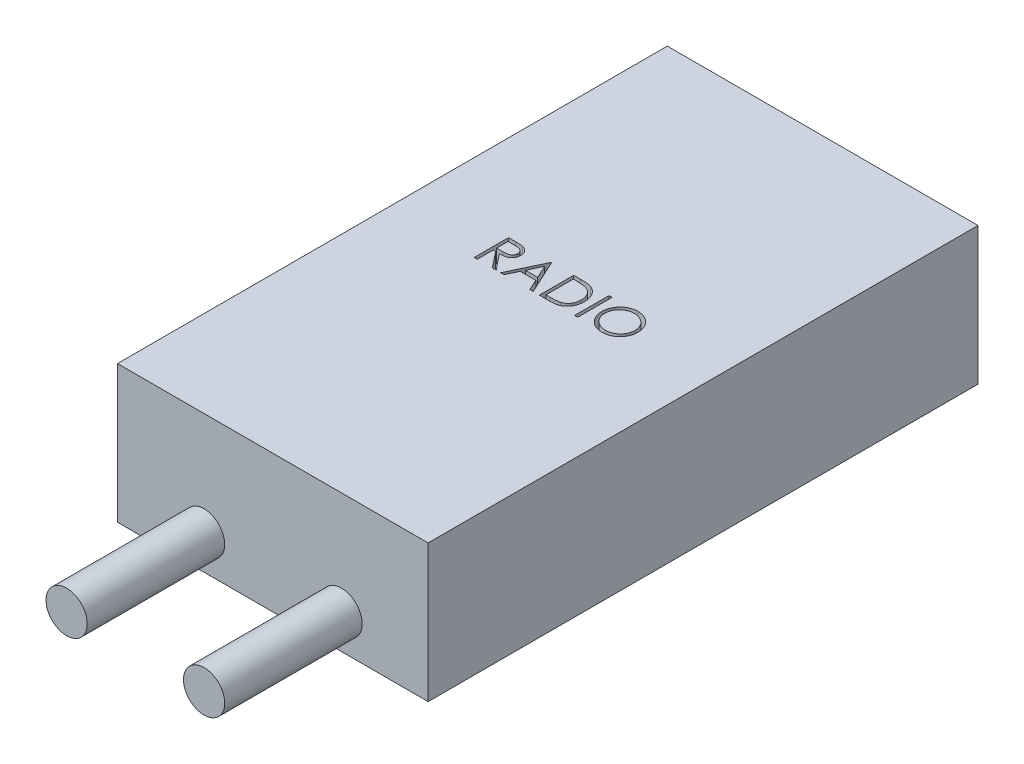
from build123d import *

# Parameters (mm, degrees)
SKETCH1_W           = 28.702
SKETCH1_H           = 50.8
BOSS_EXTRUDE1_DEPTH = 12.7
SKETCH2_R           = 1.905
BOSS_EXTRUDE2_DEPTH = 12.7
SKETCH3_W           = 0.284935897
SKETCH3_H           = 3.175
CUT_EXTRUDE1_DEPTH  = 1.27


with BuildPart() as part:
    # Sketch1 → Boss-Extrude1 (new body)
    with BuildSketch(Plane(origin=(0, 0, 0), x_dir=(1, 0, 0), z_dir=(0, 1, 0))):
        Rectangle(SKETCH1_W, SKETCH1_H)
    extrude(amount=BOSS_EXTRUDE1_DEPTH)

    # Sketch2 → Boss-Extrude2 (add)
    with BuildSketch(Plane.XY.offset(25.4)):
        with Locations((-6.35, 3.175)):
            Circle(SKETCH2_R)
        with Locations((6.35, 3.175)):
            Circle(SKETCH2_R)
    extrude(amount=BOSS_EXTRUDE2_DEPTH)

    # Sketch3 → Cut-Extrude1 (cut)
    # profile 1 of 5: a face of its own
    with BuildSketch(Plane(origin=(0, 12.7, 0), x_dir=(1, 0, 0), z_dir=(0, 1, 0))):
        with BuildLine():
            Line((-6.362474598, 2.738153854), (-5.727092987, 2.738153854))
            add(Edge.make_bspline(
                [(-5.727092987, 2.738153854), (-5.684692106, 2.738012716), (-5.603277718, 2.737741714), (-5.486643394, 2.736230629), (-5.380664528, 2.731899606), (-5.285396531, 2.728172534), (-5.200841151, 2.721376273), (-5.126739108, 2.714880543), (-5.063431697, 2.706377294), (-5.025108675, 2.698480231), (-5.00775705, 2.694904656)],
                knots=[0, 0, 0, 0, 1.410062039, 2.707475311, 3.878576406, 4.937260626, 5.877586885, 6.699081471, 7.410979367, 8, 8, 8, 8], degree=3))
            add(Edge.make_bspline(
                [(-5.00775705, 2.694904656), (-4.984528183, 2.689165376), (-4.938565986, 2.67780925), (-4.872389855, 2.653806612), (-4.809330432, 2.626030238), (-4.749649663, 2.593406006), (-4.693646481, 2.555691742), (-4.640743442, 2.513538517), (-4.590700486, 2.46717698), (-4.545541436, 2.415438231), (-4.50296101, 2.361157969), (-4.46704847, 2.302462418), (-4.436090878, 2.241083746), (-4.411443338, 2.176397732), (-4.39159689, 2.109031696), (-4.377603087, 2.03837543), (-4.369210939, 1.964750831), (-4.368356541, 1.9145333), (-4.367923316, 1.889070321)],
                knots=[0, 0, 0, 0, 1.027469482, 2.033020251, 3.019912614, 3.986113645, 4.951240523, 5.91722682, 6.890402269, 7.87763091, 8.8651537, 9.85103654, 10.82876324, 11.815024772, 12.821070561, 13.842952187, 14.906261191, 16, 16, 16, 16], degree=3))
            add(Edge.make_bspline(
                [(-4.367923316, 1.889070321), (-4.369255907, 1.846765619), (-4.371856137, 1.764218188), (-4.396099624, 1.644420103), (-4.435811181, 1.532669796), (-4.490533022, 1.429107974), (-4.560219261, 1.335753317), (-4.643971036, 1.253756261), (-4.741835069, 1.185140055), (-4.832938805, 1.137557868), (-4.913415258, 1.107084301), (-4.979666906, 1.085642747), (-5.051936236, 1.069076535), (-5.129530818, 1.054235559), (-5.212773562, 1.043030807), (-5.301464955, 1.034824254), (-5.39566825, 1.029695224), (-5.460382977, 1.028931405), (-5.493674518, 1.02853847)],
                knots=[0, 0, 0, 0, 1.260483769, 2.459530307, 3.627416485, 4.787058657, 5.939039949, 7.08810263, 8.267026773, 9.491475466, 10.141966685, 10.831826277, 11.566392101, 12.351337768, 13.187381173, 14.07005841, 15.007169909, 16, 16, 16, 16], degree=3))
            Line((-5.493674518, 1.02853847), (-4.327218187, -0.436846146))
            Line((-4.327218187, -0.436846146), (-4.679571954, -0.436846146))
            Line((-4.679571954, -0.436846146), (-5.846028284, 1.02853847))
            Line((-5.846028284, 1.02853847), (-6.0775387, 1.02853847))
            Line((-6.0775387, 1.02853847), (-6.0775387, -0.436846146))
            Line((-6.0775387, -0.436846146), (-6.362474598, -0.436846146))
            Line((-6.362474598, -0.436846146), (-6.362474598, 2.738153854))
        make_face()
        with BuildLine():
            Line((-6.0775387, 2.412512829), (-6.0775387, 1.354179495))
            Line((-6.0775387, 1.354179495), (-5.496218588, 1.349727372))
            add(Edge.make_bspline(
                [(-5.496218588, 1.349727372), (-5.469076839, 1.349715364), (-5.416468397, 1.34969209), (-5.340358509, 1.353315016), (-5.269492407, 1.357436455), (-5.204141154, 1.363740504), (-5.144275553, 1.37186494), (-5.089925528, 1.382027648), (-5.04100236, 1.393867733), (-4.9839444, 1.412193493), (-4.920229832, 1.441227524), (-4.850986294, 1.483469084), (-4.792019887, 1.536599642), (-4.742201541, 1.597354134), (-4.702169842, 1.664152731), (-4.673946764, 1.736194723), (-4.656037549, 1.811661387), (-4.653925225, 1.863530099), (-4.652859213, 1.889706338)],
                knots=[0, 0, 0, 0, 1.146690395, 2.22261258, 3.21895312, 4.145990853, 4.996080663, 5.770904154, 6.481378293, 7.121626537, 8.300444488, 9.431385265, 10.535395872, 11.636531494, 12.74115979, 13.810798291, 14.895190096, 16, 16, 16, 16], degree=3))
            add(Edge.make_bspline(
                [(-4.652859213, 1.889706338), (-4.653949709, 1.915239302), (-4.656110673, 1.965836318), (-4.673753484, 2.039909894), (-4.703588852, 2.109820627), (-4.743795453, 2.175284124), (-4.792780401, 2.234707185), (-4.850218703, 2.285549959), (-4.914539844, 2.327504831), (-4.974657288, 2.354314876), (-5.028391181, 2.370752171), (-5.07504523, 2.382319299), (-5.127760642, 2.391612495), (-5.186793379, 2.399058379), (-5.25189143, 2.405458222), (-5.323383949, 2.409768764), (-5.4007966, 2.41232134), (-5.454451316, 2.412447514), (-5.4822262, 2.412512829)],
                knots=[0, 0, 0, 0, 1.101028733, 2.181837193, 3.264309656, 4.369019818, 5.486613113, 6.575447106, 7.666700264, 8.788928104, 9.402425223, 10.0903467, 10.862060571, 11.710948788, 12.657782767, 13.684531032, 14.801375019, 16, 16, 16, 16], degree=3))
            Line((-5.4822262, 2.412512829), (-6.0775387, 2.412512829))
        make_face(mode=Mode.SUBTRACT)
    # profile 2 of 5: a face of its own
    with BuildSketch(Plane(origin=(0, 12.7, 0), x_dir=(1, 0, 0), z_dir=(0, 1, 0))):
        Polygon((-2.373372034, 2.738153854), (-0.907987418, -0.436846146), (-1.217728003, -0.436846146), (-1.687109013, 0.58078206), (-3.126416905, 0.58078206), (-3.609154285, -0.436846146), (-3.920166905, -0.436846146), (-2.414077162, 2.738153854), align=None)
        Polygon((-2.396904686, 2.119308702), (-2.971864622, 0.906423085), (-1.837209173, 0.906423085), align=None, mode=Mode.SUBTRACT)
    # profile 3 of 5: a face of its own
    with BuildSketch(Plane(origin=(0, 12.7, 0), x_dir=(1, 0, 0), z_dir=(0, 1, 0))):
        with BuildLine():
            Line((-0.338115623, -0.436846146), (-0.338115623, 2.738153854))
            Line((-0.338115623, 2.738153854), (0.302990146, 2.738153854))
            add(Edge.make_bspline(
                [(0.302990146, 2.738153854), (0.358751299, 2.73775238), (0.466481558, 2.736976734), (0.622158564, 2.732058758), (0.76619812, 2.723358835), (0.898126499, 2.710686479), (1.018305884, 2.695126227), (1.126399765, 2.675622289), (1.222967066, 2.652591592), (1.282357201, 2.632956076), (1.310442069, 2.623670681)],
                knots=[0, 0, 0, 0, 1.314313732, 2.53924729, 3.670748893, 4.714932338, 5.66265055, 6.526160246, 7.303039223, 8, 8, 8, 8], degree=3))
            add(Edge.make_bspline(
                [(1.310442069, 2.623670681), (1.347176582, 2.609672827), (1.419812593, 2.581994543), (1.523233339, 2.529782755), (1.620592776, 2.470625156), (1.712413, 2.404443766), (1.796596607, 2.329364679), (1.876432342, 2.24857718), (1.94865427, 2.159143471), (2.01479251, 2.062918303), (2.074424144, 1.961035227), (2.126257523, 1.853688379), (2.169305074, 1.741422911), (2.205040358, 1.624551027), (2.23320393, 1.502815742), (2.252418968, 1.376075306), (2.265092652, 1.244830613), (2.266366327, 1.155772349), (2.267012582, 1.110584744)],
                knots=[0, 0, 0, 0, 0.984719456, 1.947108742, 2.898477687, 3.838006223, 4.779231079, 5.722358779, 6.681677486, 7.655904652, 8.64651281, 9.637519902, 10.640069247, 11.656948941, 12.698408672, 13.768548281, 14.867775369, 16, 16, 16, 16], degree=3))
            add(Edge.make_bspline(
                [(2.267012582, 1.110584744), (2.266442018, 1.07134062), (2.265317664, 0.994005976), (2.255221784, 0.880031735), (2.240547551, 0.76943871), (2.217828886, 0.662753539), (2.190249463, 0.559041513), (2.154903412, 0.459407977), (2.11441264, 0.36293895), (2.067195964, 0.270938811), (2.015360565, 0.183777466), (1.959732984, 0.101612523), (1.900372553, 0.025616428), (1.836713229, -0.044440955), (1.769577658, -0.108454016), (1.698526301, -0.166957487), (1.623375819, -0.218806647), (1.544462806, -0.266038953), (1.459485174, -0.307241704), (1.366833353, -0.342103213), (1.266112213, -0.370992642), (1.157568981, -0.395096241), (1.041016112, -0.414216365), (0.916339335, -0.427031021), (0.783730208, -0.435696896), (0.692671875, -0.436455624), (0.645803647, -0.436846146)],
                knots=[0, 0, 0, 0, 1.105936401, 2.179363191, 3.223086493, 4.248585256, 5.251745608, 6.245858792, 7.225916811, 8.198733463, 9.158002045, 10.082870192, 10.993790845, 11.873723703, 12.748670949, 13.606408763, 14.465103618, 15.319838547, 16.196477973, 17.123216899, 18.106603292, 19.147568657, 20.255746949, 21.433717677, 22.679120308, 24, 24, 24, 24], degree=3))
            Line((0.645803647, -0.436846146), (-0.338115623, -0.436846146))
        make_face()
        with BuildLine():
            Line((-0.053179726, -0.11120512), (0.311258375, -0.11120512))
            add(Edge.make_bspline(
                [(0.311258375, -0.11120512), (0.363626254, -0.110980061), (0.464348864, -0.110547191), (0.609181476, -0.106748799), (0.741514929, -0.100542184), (0.861368012, -0.091856221), (0.968673056, -0.080363977), (1.063654314, -0.067550673), (1.146000442, -0.051587271), (1.195829288, -0.037117472), (1.21885553, -0.030430881)],
                knots=[0, 0, 0, 0, 1.375205317, 2.645023457, 3.804390687, 4.853969522, 5.800190428, 6.637939096, 7.370582563, 8, 8, 8, 8], degree=3))
            add(Edge.make_bspline(
                [(1.21885553, -0.030430881), (1.247837259, -0.020224111), (1.305108488, -5.4358e-05), (1.387550615, 0.036737235), (1.464437327, 0.080318255), (1.537108564, 0.128761747), (1.604533458, 0.183776334), (1.66751105, 0.244165731), (1.725914541, 0.310237277), (1.77914052, 0.381908967), (1.826773053, 0.45873471), (1.868021954, 0.539959223), (1.904172986, 0.624692544), (1.932547138, 0.714235852), (1.954786275, 0.807788641), (1.970538528, 0.905357492), (1.980349028, 1.006924183), (1.981493341, 1.076005039), (1.982076684, 1.111220761)],
                knots=[0, 0, 0, 0, 0.998632004, 1.973411704, 2.929992603, 3.868527914, 4.809262121, 5.754881198, 6.702106254, 7.672490631, 8.653608572, 9.636854334, 10.631411391, 11.644891563, 12.686317036, 13.754757253, 14.855430412, 16, 16, 16, 16], degree=3))
            add(Edge.make_bspline(
                [(1.982076684, 1.111220761), (1.981611059, 1.148353276), (1.980696335, 1.221300429), (1.969198925, 1.328334845), (1.952397228, 1.431278007), (1.928100599, 1.530136798), (1.897139016, 1.625104089), (1.858499591, 1.715654645), (1.814352015, 1.802744776), (1.761825416, 1.884364379), (1.704298414, 1.961555985), (1.640455623, 2.03227223), (1.571311345, 2.096674202), (1.497619732, 2.155764865), (1.417303935, 2.207166913), (1.332255944, 2.253146974), (1.241228085, 2.292168533), (1.177897996, 2.31292293), (1.145713503, 2.323470361)],
                knots=[0, 0, 0, 0, 1.122418816, 2.205001699, 3.251619955, 4.274784885, 5.280384055, 6.268708349, 7.249350384, 8.229342522, 9.199999885, 10.157847722, 11.105861043, 12.055065948, 13.010012805, 13.98527497, 14.976112212, 16, 16, 16, 16], degree=3))
            add(Edge.make_bspline(
                [(1.145713503, 2.323470361), (1.11908782, 2.33083312), (1.062474314, 2.346488367), (0.970091371, 2.36356567), (0.866119057, 2.378628322), (0.750095757, 2.391380972), (0.622153726, 2.400531614), (0.482194566, 2.407399878), (0.330157782, 2.412032323), (0.224763626, 2.41234865), (0.170062462, 2.412512829)],
                knots=[0, 0, 0, 0, 0.674548936, 1.434276114, 2.292660221, 3.240891867, 4.284742987, 5.42552168, 6.663806718, 8, 8, 8, 8], degree=3))
            Line((0.170062462, 2.412512829), (-0.053179726, 2.412512829))
            Line((-0.053179726, 2.412512829), (-0.053179726, -0.11120512))
        make_face(mode=Mode.SUBTRACT)
    # profile 4 of 5: a face of its own
    with BuildSketch(Plane(origin=(0, 12.7, 0), x_dir=(1, 0, 0), z_dir=(0, 1, 0))):
        with Locations((3.060762582, 1.150653854)):
            Rectangle(SKETCH3_W, SKETCH3_H)
    # profile 5 of 5: a face of its own
    with BuildSketch(Plane(origin=(0, 12.7, 0), x_dir=(1, 0, 0), z_dir=(0, 1, 0))):
        with BuildLine():
            add(Edge.make_bspline(
                [(5.503070274, 2.819564111), (5.561860484, 2.818075055), (5.677329308, 2.815150425), (5.847032965, 2.792762953), (6.00904423, 2.754032135), (6.164682856, 2.702449286), (6.312087199, 2.633638522), (6.452366766, 2.550466995), (6.585187787, 2.45206335), (6.70876004, 2.339188266), (6.821841702, 2.216376133), (6.921469471, 2.085314028), (7.00496498, 1.946794401), (7.073532087, 1.801233504), (7.127324397, 1.648960533), (7.164443815, 1.489163688), (7.188154852, 1.322878333), (7.190926878, 1.209461106), (7.192333095, 1.15192589)],
                knots=[0, 0, 0, 0, 1.065120563, 2.091984664, 3.0946048, 4.079830382, 5.057816894, 6.036188127, 7.030412546, 8.04752943, 9.064399622, 10.05169764, 11.02544977, 11.989514704, 12.962713494, 13.945757189, 14.957906945, 16, 16, 16, 16], degree=3))
            add(Edge.make_bspline(
                [(7.192333095, 1.15192589), (7.190927084, 1.094814492), (7.188155675, 0.98224131), (7.164416856, 0.817011186), (7.127186806, 0.658178911), (7.074031621, 0.506009641), (7.005791366, 0.360342851), (6.921739889, 0.221561828), (6.82273322, 0.089621076), (6.710059862, -0.034033984), (6.587231774, -0.147424547), (6.455487175, -0.246229527), (6.317788949, -0.331250697), (6.172365142, -0.399090173), (6.021144394, -0.453311844), (5.862773287, -0.490280301), (5.697993913, -0.514126404), (5.585625217, -0.51686463), (5.528510979, -0.518256402)],
                knots=[0, 0, 0, 0, 1.043624062, 2.057103931, 3.04512605, 4.022047818, 4.998200453, 5.980619268, 6.982898556, 8.009068085, 9.034988726, 10.034168286, 11.015286542, 11.987931943, 12.962482838, 13.94673481, 14.956375938, 16, 16, 16, 16], degree=3))
            add(Edge.make_bspline(
                [(5.528510979, -0.518256402), (5.470976061, -0.516850887), (5.357559423, -0.514080242), (5.191065112, -0.490329968), (5.031156016, -0.453190357), (4.878289426, -0.400113939), (4.732380097, -0.331518309), (4.593142664, -0.247875765), (4.461136009, -0.148627858), (4.337454568, -0.035991037), (4.224289224, 0.086628871), (4.125628933, 0.218014231), (4.04196758, 0.355587395), (3.973602272, 0.499730149), (3.919478083, 0.649745672), (3.882552998, 0.806634648), (3.858662528, 0.969502629), (3.855909488, 1.080394401), (3.854512582, 1.136661467)],
                knots=[0, 0, 0, 0, 1.053102029, 2.075944431, 3.073151272, 4.055350789, 5.033113405, 6.020478099, 7.024410459, 8.052272461, 9.079885166, 10.07527673, 11.055994387, 12.023226415, 12.992069828, 13.970394897, 14.97016774, 16, 16, 16, 16], degree=3))
            add(Edge.make_bspline(
                [(3.854512582, 1.136661467), (3.854997573, 1.174428245), (3.855961436, 1.249485357), (3.867565328, 1.360942916), (3.884403443, 1.470608012), (3.908535178, 1.578168801), (3.94009619, 1.68336198), (3.977336243, 1.786913029), (4.022820246, 1.88777255), (4.074237691, 1.986418341), (4.131625188, 2.081312656), (4.195012475, 2.171010563), (4.262173131, 2.256264753), (4.335799924, 2.334865964), (4.41346627, 2.409100781), (4.496432085, 2.477828388), (4.584191121, 2.541668522), (4.677120994, 2.599199832), (4.772931858, 2.651232761), (4.871698649, 2.695884011), (4.972079967, 2.734207224), (5.074545969, 2.765268544), (5.178824555, 2.789790463), (5.285143317, 2.806488562), (5.393417554, 2.818122051), (5.466362107, 2.819081356), (5.503070274, 2.819564111)],
                knots=[0, 0, 0, 0, 1.037015668, 2.060948919, 3.074880161, 4.083647147, 5.086022904, 6.090072063, 7.104153813, 8.122640571, 9.144368836, 10.147691507, 11.138137339, 12.123020368, 13.103399296, 14.087645067, 15.080126199, 16.082011238, 17.087798457, 18.072939717, 19.057185487, 20.037253025, 21.01195951, 21.997135196, 22.992090687, 24, 24, 24, 24], degree=3))
        make_face()
        with BuildLine():
            add(Edge.make_bspline(
                [(5.517062662, 2.493923085), (5.486932244, 2.493555792), (5.426959458, 2.492824717), (5.337801343, 2.483194746), (5.249815803, 2.469469775), (5.162984667, 2.449892253), (5.077671248, 2.423218576), (4.99308032, 2.392520038), (4.909983264, 2.35512662), (4.828654408, 2.312878524), (4.749810018, 2.266116289), (4.675412782, 2.214434758), (4.605270097, 2.159045926), (4.539553706, 2.099820531), (4.478456571, 2.036456963), (4.420776163, 1.969915825), (4.368824471, 1.898295181), (4.321212555, 1.823537169), (4.278606014, 1.745739163), (4.240718871, 1.665720217), (4.209727234, 1.582827601), (4.184452079, 1.497960615), (4.16349725, 1.41125367), (4.150222191, 1.322049007), (4.140486407, 1.230794869), (4.139797119, 1.169125616), (4.139448479, 1.137933502)],
                knots=[0, 0, 0, 0, 1.008559885, 2.007477868, 2.99961109, 3.989939068, 4.984837346, 5.991145699, 7.001802488, 8.033829008, 9.059044045, 10.069351652, 11.065060232, 12.050310815, 13.029377138, 14.011219647, 14.996725999, 15.989392538, 16.977580475, 17.965360261, 18.951710183, 19.937753436, 20.929683414, 21.935841486, 22.955955122, 24, 24, 24, 24], degree=3))
            add(Edge.make_bspline(
                [(4.139448479, 1.137933502), (4.140604961, 1.092066344), (4.142880119, 1.001831456), (4.162798772, 0.869598926), (4.193480134, 0.742518837), (4.238707888, 0.621286534), (4.295268803, 0.504859935), (4.365143196, 0.394271868), (4.447928224, 0.289492446), (4.541965851, 0.191253167), (4.644765735, 0.101585901), (4.753924712, 0.022879095), (4.868273341, -0.043714489), (4.988109818, -0.097966233), (5.112794371, -0.140955495), (5.243130436, -0.170418253), (5.378249781, -0.189808845), (5.47035259, -0.191670988), (5.517062662, -0.192615376)],
                knots=[0, 0, 0, 0, 1.032063989, 2.030389145, 3.003944642, 3.970395727, 4.937377036, 5.913328081, 6.909231446, 7.93887556, 8.970685674, 9.976071282, 10.964166581, 11.944589148, 12.933237628, 13.927779006, 14.949070134, 16, 16, 16, 16], degree=3))
            add(Edge.make_bspline(
                [(5.517062662, -0.192615376), (5.548458424, -0.192184026), (5.61072565, -0.191328529), (5.703340874, -0.182711872), (5.79428758, -0.16889439), (5.883438205, -0.149000153), (5.97069157, -0.124101615), (6.056411856, -0.094521748), (6.139686019, -0.057618085), (6.221564586, -0.016843871), (6.29993832, 0.029638272), (6.37475541, 0.079565736), (6.444130049, 0.134872985), (6.509797278, 0.193218429), (6.571145253, 0.255778491), (6.627759117, 0.322471835), (6.679448237, 0.393719431), (6.727042073, 0.468364049), (6.769499319, 0.546374936), (6.806491787, 0.626684001), (6.837875407, 0.709093493), (6.86321055, 0.793722275), (6.883063791, 0.880409617), (6.896743432, 0.969271588), (6.906312373, 1.06013042), (6.907033622, 1.121583775), (6.907397197, 1.152561907)],
                knots=[0, 0, 0, 0, 1.047197238, 2.076906641, 3.100256066, 4.114471768, 5.12198147, 6.126382909, 7.136867548, 8.15857795, 9.17633901, 10.174870724, 11.156907918, 12.133735059, 13.104061851, 14.077631395, 15.04955518, 16.038496417, 17.029181396, 18.010275684, 18.986308667, 19.968651475, 20.955262928, 21.950658345, 22.966943676, 24, 24, 24, 24], degree=3))
            add(Edge.make_bspline(
                [(6.907397197, 1.152561907), (6.90703333, 1.183328115), (6.906311534, 1.244358555), (6.896748003, 1.334583725), (6.883049338, 1.422806282), (6.863307453, 1.508679874), (6.837861956, 1.592226393), (6.806486307, 1.673367372), (6.769488214, 1.752405092), (6.727026467, 1.829144204), (6.679296399, 1.902781288), (6.627140907, 1.973177762), (6.569659484, 2.039011606), (6.508494447, 2.101908078), (6.442118001, 2.160525735), (6.37083082, 2.214884022), (6.295498341, 2.266294778), (6.215735777, 2.312672966), (6.133418048, 2.35550302), (6.048950386, 2.392197858), (5.963289703, 2.423378281), (5.876653829, 2.449972957), (5.788313556, 2.469393098), (5.698865797, 2.483207115), (5.608434305, 2.492821365), (5.547616527, 2.49355468), (5.517062662, 2.493923085)],
                knots=[0, 0, 0, 0, 1.02996197, 2.043119294, 3.035359645, 4.018872909, 4.991431989, 5.957985074, 6.929999688, 7.912076566, 8.892894881, 9.867085534, 10.843653904, 11.817741046, 12.803660682, 13.806313499, 14.818574707, 15.856120519, 16.894564902, 17.924820532, 18.937903209, 19.946497019, 20.957711757, 21.963978472, 22.977135795, 24, 24, 24, 24], degree=3))
        make_face(mode=Mode.SUBTRACT)
    extrude(amount=-CUT_EXTRUDE1_DEPTH, mode=Mode.SUBTRACT)


solid = part.part
